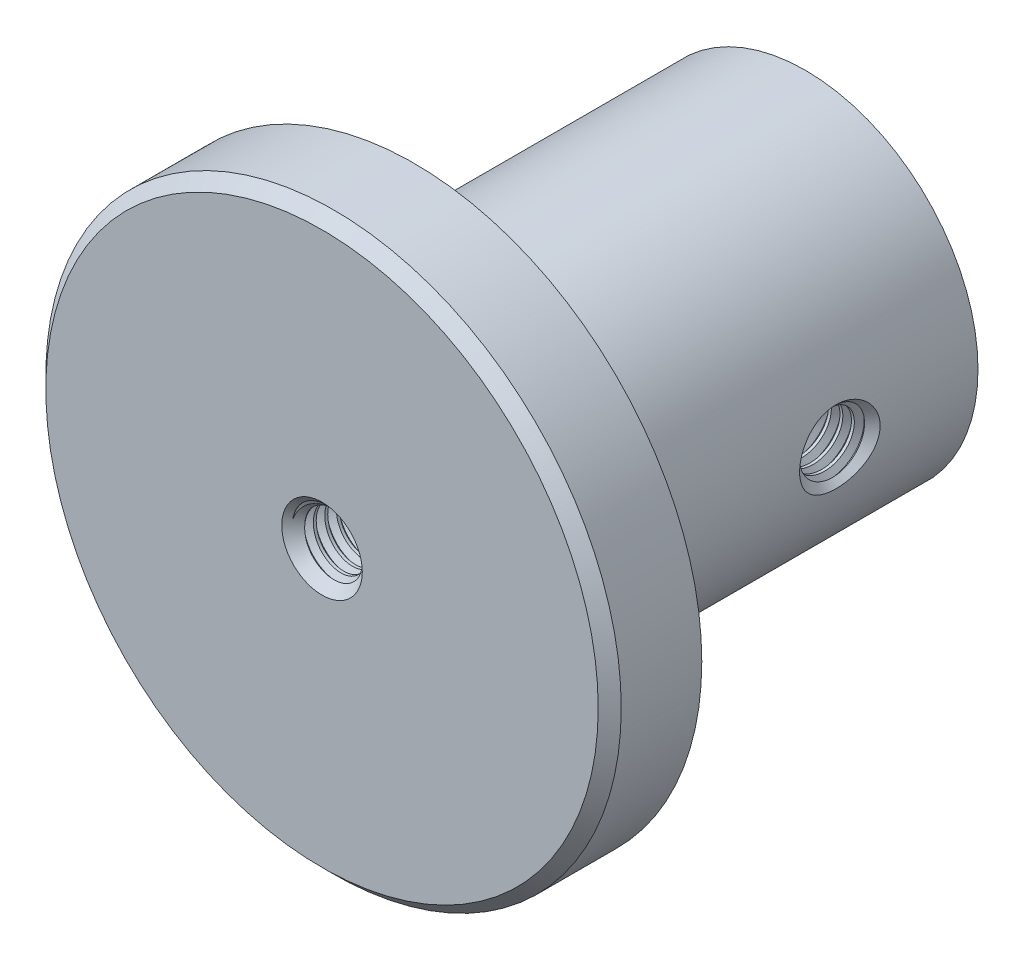
from build123d import *

# Parameters (mm, degrees)
SKETCH1_R               = 12.5
BOSS_EXTRUDE1_DEPTH     = 4
CHAMFER1_SIZE           = 0.5
SKETCH7_R               = 1.25
CUT_EXTRUDE1_DEPTH      = 19.12456896
THREAD1_PITCH           = 0.5
SKETCH11_R              = 7.5
BOSS_EXTRUDE2_DEPTH     = 17
SKETCH12_R              = 2.55
CUT_EXTRUDE3_DEPTH      = 15
CUT_EXTRUDE4_REACH      = 31.073
CUT_EXTRUDE4_END_RADIUS = 2.55
SKETCH13_R              = 1.25
THREAD2_PITCH           = 0.5


with BuildPart() as part:
    # Sketch1 → Boss-Extrude1 (new body)
    with BuildSketch(Plane.XY):
        Circle(SKETCH1_R)
    extrude(amount=BOSS_EXTRUDE1_DEPTH)

    # Chamfer1
    chamfer1_edges = [part.edges().sort_by_distance(p)[0] for p in [
        (-12.5, 0, 4),
    ]]
    chamfer(chamfer1_edges, length=CHAMFER1_SIZE)

    # Sketch7 → Cut-Extrude1 (cut, through all)
    with BuildSketch(Plane.XY.offset(4)):
        Circle(SKETCH7_R)
    extrude(amount=-CUT_EXTRUDE1_DEPTH, mode=Mode.SUBTRACT)

    # Thread1: the profile of Thread Profile1 profile screwed along a right-hand helix of 10 turns, 6 arcs to a turn; built about Z, then put on its axis
    thread1_z = Axis((0, 0, 0), (0, 0, 1))
    thread1_corners = [(1.2497, 0, -0.000173205), (1.520632938, 0, 0.156249999), (1.520632937, 0, 0.218749999), (1.2497, 0, 0.375173204)]
    with BuildLine(mode=Mode.PRIVATE) as thread1_profile:
        Line(thread1_corners[0], thread1_corners[1])
        Line(thread1_corners[1], thread1_corners[2])
        Line(thread1_corners[2], thread1_corners[3])
        Line(thread1_corners[3], thread1_corners[0])
    thread1_cap = Face(thread1_profile.wire())
    thread1_turn_angles = [0, 30, 60, 90, 120, 150, 180, 210, 240, 270, 300, 330, 360]
    thread1_turn_weights = [1, 0.8660254037844387, 1, 0.8660254037844387, 1, 0.8660254037844387, 1, 0.8660254037844387, 1, 0.8660254037844387, 1, 0.8660254037844387, 1]
    thread1_turn_rails = [Edge.make_bspline([Vector(p[0], p[1], 0).rotate(thread1_z, thread1_turn_angles[k]) / thread1_turn_weights[k] + Vector(0, 0, p[2] + THREAD1_PITCH * thread1_turn_angles[k] / 360) for k in range(13)], [0, 0, 0, 1, 1, 2, 2, 3, 3, 4, 4, 5, 5, 6, 6, 6], 2, thread1_turn_weights) for p in thread1_corners]
    thread1_turn_sides = [Face.make_surface_from_curves(thread1_turn_rails[p[0]], thread1_turn_rails[p[1]]) for p in [(0, 1), (1, 2), (2, 3), (3, 0)]]
    thread1 = Plane(origin=(0, 0, 5), x_dir=(-1, 0, 0), z_dir=(0, 0, -1)) * Solid(Shell([*[p.moved(Location((0, 0, THREAD1_PITCH * i))) for i in range(10) for p in thread1_turn_sides], thread1_cap, thread1_cap.rotate(thread1_z, 3600).moved(Location((0, 0, THREAD1_PITCH * 3600 / 360)))]))
    add(thread1, mode=Mode.SUBTRACT)

    # Cut-Extrude2 cone 1 section (through the dimple's axis) → Cut-Extrude2 (revolve, cut)
    with BuildSketch(Plane(origin=(0, 0, 4), x_dir=(0, -1, 0), z_dir=(1, 0, 0))):
        Polygon((0, 0), (1.75, 0), (0, 1.75), align=None)
    revolve(axis=Axis((0, 0, 4), (0, 0, -1)), mode=Mode.SUBTRACT)

    # Sketch11 → Boss-Extrude2 (add)
    with BuildSketch(Plane(origin=(0, 0, 0), x_dir=(-1, 0, 0), z_dir=(0, 0, -1))):
        with Locations(Location((0, 0, 0), (0, 0, 180))):
            Circle(SKETCH11_R)
    extrude(amount=BOSS_EXTRUDE2_DEPTH)

    # Sketch12 → Cut-Extrude3 (cut)
    with BuildSketch(Plane(origin=(0, 0, -17), x_dir=(-1, 0, 0), z_dir=(0, 0, -1))):
        Circle(SKETCH12_R)
    extrude(amount=-CUT_EXTRUDE3_DEPTH, mode=Mode.SUBTRACT)

    # Cut-Extrude4: up to this cylinder (the profile starts outside it)
    cut_extrude4_end = Plane(origin=(0, 0, -11), z_dir=(0, 0, -1)) * Cylinder(CUT_EXTRUDE4_END_RADIUS, 68.246, mode=Mode.PRIVATE)
    # Sketch13 → Cut-Extrude4 (cut, up to the surface)
    with BuildSketch(Plane(origin=(7.5, 0, 0), x_dir=(0, 0, -1), z_dir=(1, 0, 0)), mode=Mode.PRIVATE) as cut_extrude4_sk1:
        with Locations((11, 0)):
            Circle(SKETCH13_R)
    cut_extrude4_tool1 = extrude(cut_extrude4_sk1.sketch, amount=-CUT_EXTRUDE4_REACH, mode=Mode.PRIVATE) - cut_extrude4_end
    add(cut_extrude4_tool1.solids().sort_by_distance((7.5, 0, -11))[0], mode=Mode.SUBTRACT)

    # Thread2: the profile of Thread Profile2 profile screwed along a right-hand helix of 16 turns, 6 arcs to a turn; built about Z, then put on its axis
    thread2_z = Axis((0, 0, 0), (0, 0, 1))
    thread2_corners = [(1.2497, 0, -0.000173205), (1.520632937, 0, 0.156249999), (1.520632937, 0, 0.218749999), (1.2497, 0, 0.375173204)]
    with BuildLine(mode=Mode.PRIVATE) as thread2_profile:
        Line(thread2_corners[0], thread2_corners[1])
        Line(thread2_corners[1], thread2_corners[2])
        Line(thread2_corners[2], thread2_corners[3])
        Line(thread2_corners[3], thread2_corners[0])
    thread2_cap = Face(thread2_profile.wire())
    thread2_turn_angles = [0, 30, 60, 90, 120, 150, 180, 210, 240, 270, 300, 330, 360]
    thread2_turn_weights = [1, 0.8660254037844387, 1, 0.8660254037844387, 1, 0.8660254037844387, 1, 0.8660254037844387, 1, 0.8660254037844387, 1, 0.8660254037844387, 1]
    thread2_turn_rails = [Edge.make_bspline([Vector(p[0], p[1], 0).rotate(thread2_z, thread2_turn_angles[k]) / thread2_turn_weights[k] + Vector(0, 0, p[2] + THREAD2_PITCH * thread2_turn_angles[k] / 360) for k in range(13)], [0, 0, 0, 1, 1, 2, 2, 3, 3, 4, 4, 5, 5, 6, 6, 6], 2, thread2_turn_weights) for p in thread2_corners]
    thread2_turn_sides = [Face.make_surface_from_curves(thread2_turn_rails[p[0]], thread2_turn_rails[p[1]]) for p in [(0, 1), (1, 2), (2, 3), (3, 0)]]
    thread2 = Plane(origin=(8.5, 0, -11), x_dir=(0, 0, 1), z_dir=(-1, 0, 0)) * Solid(Shell([*[p.moved(Location((0, 0, THREAD2_PITCH * i))) for i in range(16) for p in thread2_turn_sides], thread2_cap, thread2_cap.rotate(thread2_z, 5760).moved(Location((0, 0, THREAD2_PITCH * 5760 / 360)))]))
    add(thread2, mode=Mode.SUBTRACT)

    # Cut-Extrude5 cone 1 section (through the dimple's axis) → Cut-Extrude5 (revolve, cut)
    with BuildSketch(Plane(origin=(7.5, 0, -11), x_dir=(0, 0, -1), z_dir=(0, 1, 0))):
        Polygon((0, 0), (1.75, 0), (0, 1.75), align=None)
    revolve(axis=Axis((7.5, 0, -11), (-1, 0, 0)), mode=Mode.SUBTRACT)


solid = part.part
